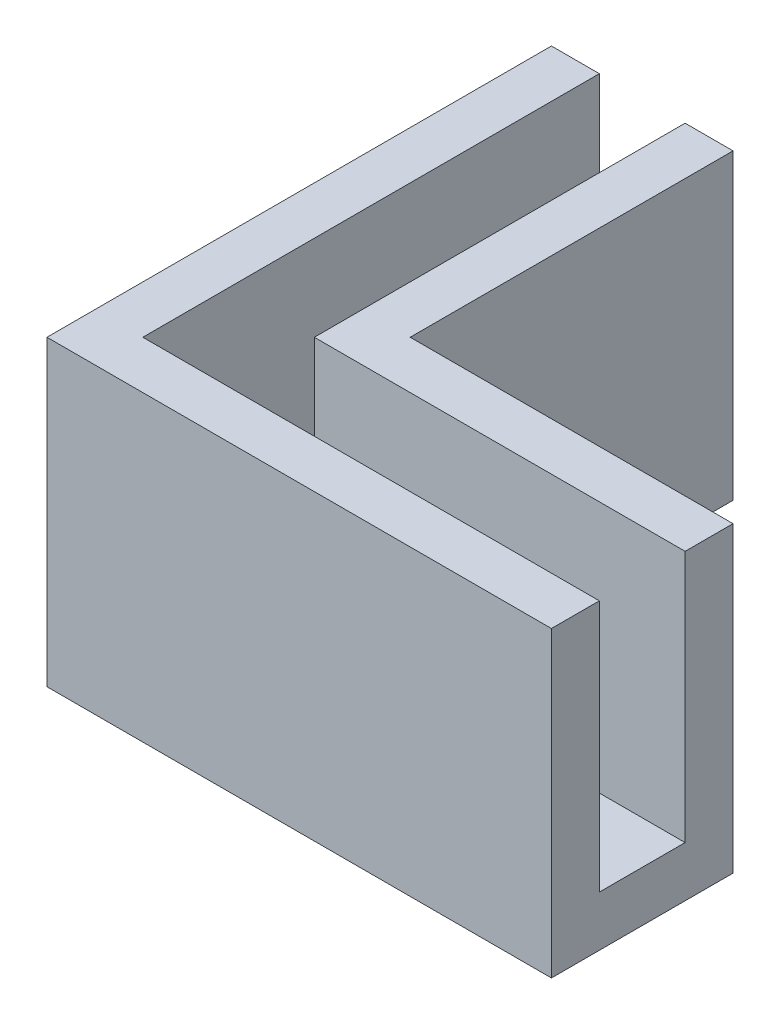
from build123d import *

# Parameters (mm, degrees)
BOSS_EXTRUDE1_DEPTH = 5
BOSS_EXTRUDE2_DEPTH = 30


with BuildPart() as part:
    # Sketch1 → Boss-Extrude1 (new body)
    with BuildSketch(Plane(origin=(0, 0, 0), x_dir=(1, 0, 0), z_dir=(0, 1, 0))):
        Polygon((13.25, 50), (4.75, 50), (4.75, 4.75), (50, 4.75), (50, 13.25), (13.25, 13.25), align=None)
    extrude(amount=BOSS_EXTRUDE1_DEPTH)

    # Sketch1<3> → Boss-Extrude2 (add)
    with BuildSketch(Plane(origin=(0, 0, 0), x_dir=(1, 0, 0), z_dir=(0, 1, 0))):
        Polygon((0, 50), (0, 0), (50, 0), (50, 4.75), (4.75, 4.75), (4.75, 50), align=None)
        Polygon((18, 50), (13.25, 50), (13.25, 13.25), (50, 13.25), (50, 18), (18, 18), align=None)
    extrude(amount=BOSS_EXTRUDE2_DEPTH)


solid = part.part
